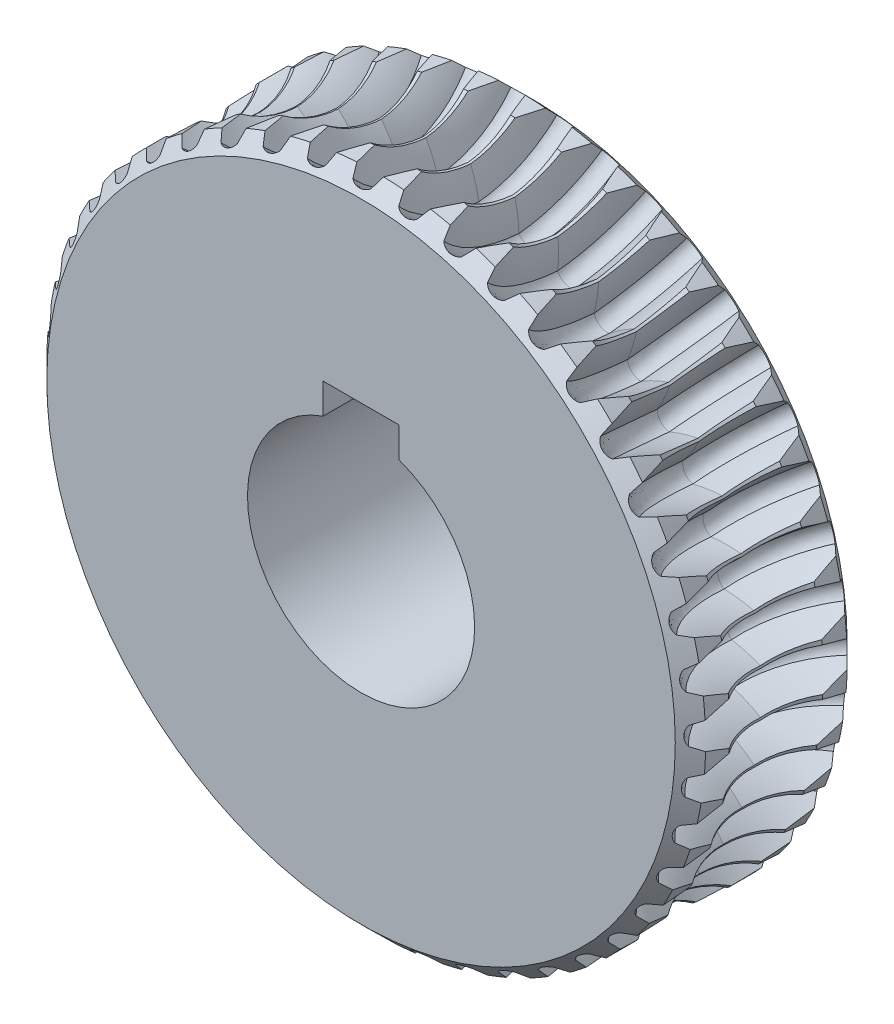
from build123d import *

# Parameters (mm, degrees)
SKETCH1_R                       = 43.5
BOSS_EXTRUDE1_DEPTH             = 11.35
CHAMFER1_SIZE                   = 2
SKETCH2_R                       = 10.5
CUT_SWEEP1_PITCH                = 6
CUT_SWEEP1_HEIGHT               = 1.5
CUT_SWEEP1_RADIUS               = 10.5
CUT_SWEEP1_START_ANGLE          = -90
CIRPATTERN1_COUNT               = 44
CIRPATTERN1_COPY_1_PITCH        = 6
CIRPATTERN1_COPY_1_HEIGHT       = 1.5
CIRPATTERN1_COPY_1_RADIUS       = 10.5
CIRPATTERN1_COPY_2_PITCH        = 6
CIRPATTERN1_COPY_2_HEIGHT       = 1.5
CIRPATTERN1_COPY_2_RADIUS       = 10.5
CIRPATTERN1_COPY_3_PITCH        = 6
CIRPATTERN1_COPY_3_HEIGHT       = 1.5
CIRPATTERN1_COPY_3_RADIUS       = 10.5
CIRPATTERN1_COPY_4_PITCH        = 6
CIRPATTERN1_COPY_4_HEIGHT       = 1.5
CIRPATTERN1_COPY_4_RADIUS       = 10.5
CIRPATTERN1_COPY_5_PITCH        = 6
CIRPATTERN1_COPY_5_HEIGHT       = 1.5
CIRPATTERN1_COPY_5_RADIUS       = 10.5
CIRPATTERN1_COPY_6_PITCH        = 6
CIRPATTERN1_COPY_6_HEIGHT       = 1.5
CIRPATTERN1_COPY_6_RADIUS       = 10.5
CIRPATTERN1_COPY_6_START_ANGLE  = 180
CIRPATTERN1_COPY_7_PITCH        = 6
CIRPATTERN1_COPY_7_HEIGHT       = 1.5
CIRPATTERN1_COPY_7_RADIUS       = 10.5
CIRPATTERN1_COPY_7_START_ANGLE  = 180
CIRPATTERN1_COPY_8_PITCH        = 6
CIRPATTERN1_COPY_8_HEIGHT       = 1.5
CIRPATTERN1_COPY_8_RADIUS       = 10.5
CIRPATTERN1_COPY_8_START_ANGLE  = 180
CIRPATTERN1_COPY_9_PITCH        = 6
CIRPATTERN1_COPY_9_HEIGHT       = 1.5
CIRPATTERN1_COPY_9_RADIUS       = 10.5
CIRPATTERN1_COPY_9_START_ANGLE  = 180
CIRPATTERN1_COPY_10_PITCH       = 6
CIRPATTERN1_COPY_10_HEIGHT      = 1.5
CIRPATTERN1_COPY_10_RADIUS      = 10.5
CIRPATTERN1_COPY_10_START_ANGLE = 180
CIRPATTERN1_COPY_11_PITCH       = 6
CIRPATTERN1_COPY_11_HEIGHT      = 1.5
CIRPATTERN1_COPY_11_RADIUS      = 10.5
CIRPATTERN1_COPY_11_START_ANGLE = -90
CIRPATTERN1_COPY_12_PITCH       = 6
CIRPATTERN1_COPY_12_HEIGHT      = 1.5
CIRPATTERN1_COPY_12_RADIUS      = 10.5
CIRPATTERN1_COPY_12_START_ANGLE = 180
CIRPATTERN1_COPY_13_PITCH       = 6
CIRPATTERN1_COPY_13_HEIGHT      = 1.5
CIRPATTERN1_COPY_13_RADIUS      = 10.5
CIRPATTERN1_COPY_13_START_ANGLE = 180
CIRPATTERN1_COPY_14_PITCH       = 6
CIRPATTERN1_COPY_14_HEIGHT      = 1.5
CIRPATTERN1_COPY_14_RADIUS      = 10.5
CIRPATTERN1_COPY_14_START_ANGLE = 180
CIRPATTERN1_COPY_15_PITCH       = 6
CIRPATTERN1_COPY_15_HEIGHT      = 1.5
CIRPATTERN1_COPY_15_RADIUS      = 10.5
CIRPATTERN1_COPY_15_START_ANGLE = 180
CIRPATTERN1_COPY_16_PITCH       = 6
CIRPATTERN1_COPY_16_HEIGHT      = 1.5
CIRPATTERN1_COPY_16_RADIUS      = 10.5
CIRPATTERN1_COPY_16_START_ANGLE = 180
CIRPATTERN1_COPY_17_PITCH       = 6
CIRPATTERN1_COPY_17_HEIGHT      = 1.5
CIRPATTERN1_COPY_17_RADIUS      = 10.5
CIRPATTERN1_COPY_18_PITCH       = 6
CIRPATTERN1_COPY_18_HEIGHT      = 1.5
CIRPATTERN1_COPY_18_RADIUS      = 10.5
CIRPATTERN1_COPY_19_PITCH       = 6
CIRPATTERN1_COPY_19_HEIGHT      = 1.5
CIRPATTERN1_COPY_19_RADIUS      = 10.5
CIRPATTERN1_COPY_20_PITCH       = 6
CIRPATTERN1_COPY_20_HEIGHT      = 1.5
CIRPATTERN1_COPY_20_RADIUS      = 10.5
CIRPATTERN1_COPY_21_PITCH       = 6
CIRPATTERN1_COPY_21_HEIGHT      = 1.5
CIRPATTERN1_COPY_21_RADIUS      = 10.5
CIRPATTERN1_COPY_22_PITCH       = 6
CIRPATTERN1_COPY_22_HEIGHT      = 1.5
CIRPATTERN1_COPY_22_RADIUS      = 10.5
CIRPATTERN1_COPY_22_START_ANGLE = 90
CIRPATTERN1_COPY_23_PITCH       = 6
CIRPATTERN1_COPY_23_HEIGHT      = 1.5
CIRPATTERN1_COPY_23_RADIUS      = 10.5
CIRPATTERN1_COPY_24_PITCH       = 6
CIRPATTERN1_COPY_24_HEIGHT      = 1.5
CIRPATTERN1_COPY_24_RADIUS      = 10.5
CIRPATTERN1_COPY_25_PITCH       = 6
CIRPATTERN1_COPY_25_HEIGHT      = 1.5
CIRPATTERN1_COPY_25_RADIUS      = 10.5
CIRPATTERN1_COPY_26_PITCH       = 6
CIRPATTERN1_COPY_26_HEIGHT      = 1.5
CIRPATTERN1_COPY_26_RADIUS      = 10.5
CIRPATTERN1_COPY_27_PITCH       = 6
CIRPATTERN1_COPY_27_HEIGHT      = 1.5
CIRPATTERN1_COPY_27_RADIUS      = 10.5
CIRPATTERN1_COPY_28_PITCH       = 6
CIRPATTERN1_COPY_28_HEIGHT      = 1.5
CIRPATTERN1_COPY_28_RADIUS      = 10.5
CIRPATTERN1_COPY_28_START_ANGLE = 180
CIRPATTERN1_COPY_29_PITCH       = 6
CIRPATTERN1_COPY_29_HEIGHT      = 1.5
CIRPATTERN1_COPY_29_RADIUS      = 10.5
CIRPATTERN1_COPY_29_START_ANGLE = 180
CIRPATTERN1_COPY_30_PITCH       = 6
CIRPATTERN1_COPY_30_HEIGHT      = 1.5
CIRPATTERN1_COPY_30_RADIUS      = 10.5
CIRPATTERN1_COPY_30_START_ANGLE = 180
CIRPATTERN1_COPY_31_PITCH       = 6
CIRPATTERN1_COPY_31_HEIGHT      = 1.5
CIRPATTERN1_COPY_31_RADIUS      = 10.5
CIRPATTERN1_COPY_31_START_ANGLE = 180
CIRPATTERN1_COPY_32_PITCH       = 6
CIRPATTERN1_COPY_32_HEIGHT      = 1.5
CIRPATTERN1_COPY_32_RADIUS      = 10.5
CIRPATTERN1_COPY_32_START_ANGLE = 180
CIRPATTERN1_COPY_33_PITCH       = 6
CIRPATTERN1_COPY_33_HEIGHT      = 1.5
CIRPATTERN1_COPY_33_RADIUS      = 10.5
CIRPATTERN1_COPY_33_START_ANGLE = 90
CIRPATTERN1_COPY_34_PITCH       = 6
CIRPATTERN1_COPY_34_HEIGHT      = 1.5
CIRPATTERN1_COPY_34_RADIUS      = 10.5
CIRPATTERN1_COPY_34_START_ANGLE = 180
CIRPATTERN1_COPY_35_PITCH       = 6
CIRPATTERN1_COPY_35_HEIGHT      = 1.5
CIRPATTERN1_COPY_35_RADIUS      = 10.5
CIRPATTERN1_COPY_35_START_ANGLE = 180
CIRPATTERN1_COPY_36_PITCH       = 6
CIRPATTERN1_COPY_36_HEIGHT      = 1.5
CIRPATTERN1_COPY_36_RADIUS      = 10.5
CIRPATTERN1_COPY_36_START_ANGLE = 180
CIRPATTERN1_COPY_37_PITCH       = 6
CIRPATTERN1_COPY_37_HEIGHT      = 1.5
CIRPATTERN1_COPY_37_RADIUS      = 10.5
CIRPATTERN1_COPY_37_START_ANGLE = 180
CIRPATTERN1_COPY_38_PITCH       = 6
CIRPATTERN1_COPY_38_HEIGHT      = 1.5
CIRPATTERN1_COPY_38_RADIUS      = 10.5
CIRPATTERN1_COPY_38_START_ANGLE = 180
CIRPATTERN1_COPY_39_PITCH       = 6
CIRPATTERN1_COPY_39_HEIGHT      = 1.5
CIRPATTERN1_COPY_39_RADIUS      = 10.5
CIRPATTERN1_COPY_40_PITCH       = 6
CIRPATTERN1_COPY_40_HEIGHT      = 1.5
CIRPATTERN1_COPY_40_RADIUS      = 10.5
CIRPATTERN1_COPY_41_PITCH       = 6
CIRPATTERN1_COPY_41_HEIGHT      = 1.5
CIRPATTERN1_COPY_41_RADIUS      = 10.5
CIRPATTERN1_COPY_42_PITCH       = 6
CIRPATTERN1_COPY_42_HEIGHT      = 1.5
CIRPATTERN1_COPY_42_RADIUS      = 10.5
CIRPATTERN1_COPY_43_PITCH       = 6
CIRPATTERN1_COPY_43_HEIGHT      = 1.5
CIRPATTERN1_COPY_43_RADIUS      = 10.5


with BuildPart() as part:
    # Sketch1 → Boss-Extrude1 (new, symmetric)
    with BuildSketch(Plane.XY):
        Circle(SKETCH1_R)
        with BuildLine():
            Line((-5, 18.142135624), (5, 18.142135624))
            Line((5, 18.142135624), (5, 14.142135624))
            ThreePointArc((5, 14.142135624), (0, -15), (-5, 14.142135624))
            Line((-5, 14.142135624), (-5, 18.142135624))
        make_face(mode=Mode.SUBTRACT)
    extrude(amount=BOSS_EXTRUDE1_DEPTH, both=True)

    # Chamfer1
    chamfer1_edges = [part.edges().sort_by_distance(p)[0] for p in [
        (-43.5, 0, -11.35),
        (-43.5, 0, 11.35),
    ]]
    chamfer(chamfer1_edges, length=CHAMFER1_SIZE)

    # Sketch2 → Cut-Revolve1 (revolve, cut)
    with BuildSketch(Plane(origin=(0, 0, 0), x_dir=(0, 0, -1), z_dir=(1, 0, 0)), mode=Mode.PRIVATE) as cut_revolve1_sk:
        with Locations((0, -52)):
            Circle(SKETCH2_R)
    revolve(cut_revolve1_sk.sketch.rotate(Axis((0, 0, 11.35), (0, 0, -1)), 270), axis=Axis((0, 0, 11.35), (0, 0, -1)), mode=Mode.SUBTRACT)

    # Cut-Sweep1: sweep along a helix
    with BuildLine() as cut_sweep1_path:
        add(Helix(CUT_SWEEP1_PITCH, CUT_SWEEP1_HEIGHT, CUT_SWEEP1_RADIUS, center=(0, -52, 0), direction=(1, 0, 0), mode=Mode.PRIVATE).rotate(Axis((0, -52, 0), (1, 0, 0)), CUT_SWEEP1_START_ANGLE))
    # Sketch4 → Cut-Sweep1 (sweep, cut)
    with BuildSketch(Plane.XY):
        with BuildLine():
            Line((3.45, -44.44), (-3.45, -44.44))
            Line((-3.45, -44.44), (-3.45, -42.44))
            ThreePointArc((-3.45, -42.44), (-2.158263743, -40.196055995), (-1.201831935, -37.79))
            ThreePointArc((-1.201831935, -37.79), (0, -37.33), (1.201831935, -37.79))
            ThreePointArc((1.201831935, -37.79), (2.158263743, -40.196055995), (3.45, -42.44))
            Line((3.45, -42.44), (3.45, -44.44))
        make_face()
    cut_sweep1 = sweep(path=cut_sweep1_path.line, is_frenet=True, mode=Mode.SUBTRACT)

    # Mirror1: Cut-Sweep1 across plane
    add(cut_sweep1.mirror(Plane.XY), mode=Mode.SUBTRACT)

    # CirPattern1: Cut-Sweep1 ×44 about axis
    cirpattern1_axis = Axis((0, 0, 11.35), (0, 0, 1))
    for i in range(1, CIRPATTERN1_COUNT):
        add(cut_sweep1.rotate(cirpattern1_axis, i * 360 / CIRPATTERN1_COUNT), mode=Mode.SUBTRACT)

    # CirPattern1 copy 1: sweep along a helix
    with BuildLine() as cirpattern1_copy_1_path:
        Helix(CIRPATTERN1_COPY_1_PITCH, CIRPATTERN1_COPY_1_HEIGHT, CIRPATTERN1_COPY_1_RADIUS, center=(7.40037159, -51.470714978, 0), direction=(0.9898214418809327, 0.14231483827328514, 0), lefthand=True)
    # CirPattern1 copy 1 sketch → CirPattern1 copy 1 (sweep, cut)
    with BuildSketch(Plane(origin=(0, 0, 0), x_dir=(0.9898214418809327, 0.14231483827328514, 0), z_dir=(0, 0, -1))):
        with BuildLine():
            Line((3.45, 44.44), (-3.45, 44.44))
            Line((-3.45, 44.44), (-3.45, 42.44))
            ThreePointArc((-3.45, 42.44), (-2.158263743, 40.196055995), (-1.201831935, 37.79))
            ThreePointArc((-1.201831935, 37.79), (0, 37.33), (1.201831935, 37.79))
            ThreePointArc((1.201831935, 37.79), (2.158263743, 40.196055995), (3.45, 42.44))
            Line((3.45, 42.44), (3.45, 44.44))
        make_face()
    sweep(path=cirpattern1_copy_1_path.line, is_frenet=True, mode=Mode.SUBTRACT)

    # CirPattern1 copy 2: sweep along a helix
    with BuildLine() as cirpattern1_copy_2_path:
        Helix(CIRPATTERN1_COPY_2_PITCH, CIRPATTERN1_COPY_2_HEIGHT, CIRPATTERN1_COPY_2_RADIUS, center=(14.650092956, -49.893634628, 0), direction=(0.9594929736144974, 0.28173255684142967, 0), lefthand=True)
    # CirPattern1 copy 2 sketch → CirPattern1 copy 2 (sweep, cut)
    with BuildSketch(Plane(origin=(0, 0, 0), x_dir=(0.9594929736144974, 0.28173255684142967, 0), z_dir=(0, 0, -1))):
        with BuildLine():
            Line((3.45, 44.44), (-3.45, 44.44))
            Line((-3.45, 44.44), (-3.45, 42.44))
            ThreePointArc((-3.45, 42.44), (-2.158263743, 40.196055995), (-1.201831935, 37.79))
            ThreePointArc((-1.201831935, 37.79), (0, 37.33), (1.201831935, 37.79))
            ThreePointArc((1.201831935, 37.79), (2.158263743, 40.196055995), (3.45, 42.44))
            Line((3.45, 42.44), (3.45, 44.44))
        make_face()
    sweep(path=cirpattern1_copy_2_path.line, is_frenet=True, mode=Mode.SUBTRACT)

    # CirPattern1 copy 3: sweep along a helix
    with BuildLine() as cirpattern1_copy_3_path:
        Helix(CIRPATTERN1_COPY_3_PITCH, CIRPATTERN1_COPY_3_HEIGHT, CIRPATTERN1_COPY_3_RADIUS, center=(21.601580676, -47.300863758, 0), direction=(0.9096319953545183, 0.41541501300188644, 0), lefthand=True)
    # CirPattern1 copy 3 sketch → CirPattern1 copy 3 (sweep, cut)
    with BuildSketch(Plane(origin=(0, 0, 0), x_dir=(0.9096319953545183, 0.41541501300188644, 0), z_dir=(0, 0, -1))):
        with BuildLine():
            Line((3.45, 44.44), (-3.45, 44.44))
            Line((-3.45, 44.44), (-3.45, 42.44))
            ThreePointArc((-3.45, 42.44), (-2.158263743, 40.196055995), (-1.201831935, 37.79))
            ThreePointArc((-1.201831935, 37.79), (0, 37.33), (1.201831935, 37.79))
            ThreePointArc((1.201831935, 37.79), (2.158263743, 40.196055995), (3.45, 42.44))
            Line((3.45, 42.44), (3.45, 44.44))
        make_face()
    sweep(path=cirpattern1_copy_3_path.line, is_frenet=True, mode=Mode.SUBTRACT)

    # CirPattern1 copy 4: sweep along a helix
    with BuildLine() as cirpattern1_copy_4_path:
        Helix(CIRPATTERN1_COPY_4_PITCH, CIRPATTERN1_COPY_4_HEIGHT, CIRPATTERN1_COPY_4_RADIUS, center=(28.113322508, -43.745183707, 0), direction=(0.8412535328311812, 0.5406408174555976, 0), lefthand=True)
    # CirPattern1 copy 4 sketch → CirPattern1 copy 4 (sweep, cut)
    with BuildSketch(Plane(origin=(0, 0, 0), x_dir=(0.8412535328311812, 0.5406408174555976, 0), z_dir=(0, 0, -1))):
        with BuildLine():
            Line((3.45, 44.44), (-3.45, 44.44))
            Line((-3.45, 44.44), (-3.45, 42.44))
            ThreePointArc((-3.45, 42.44), (-2.158263743, 40.196055995), (-1.201831935, 37.79))
            ThreePointArc((-1.201831935, 37.79), (0, 37.33), (1.201831935, 37.79))
            ThreePointArc((1.201831935, 37.79), (2.158263743, 40.196055995), (3.45, 42.44))
            Line((3.45, 42.44), (3.45, 44.44))
        make_face()
    sweep(path=cirpattern1_copy_4_path.line, is_frenet=True, mode=Mode.SUBTRACT)

    # CirPattern1 copy 5: sweep along a helix
    with BuildLine() as cirpattern1_copy_5_path:
        Helix(CIRPATTERN1_COPY_5_PITCH, CIRPATTERN1_COPY_5_HEIGHT, CIRPATTERN1_COPY_5_RADIUS, center=(34.052758165, -39.298977866, 0), direction=(0.7557495743542584, 0.654860733945285, 0), lefthand=True)
    # CirPattern1 copy 5 sketch → CirPattern1 copy 5 (sweep, cut)
    with BuildSketch(Plane(origin=(0, 0, 0), x_dir=(0.7557495743542584, 0.654860733945285, 0), z_dir=(0, 0, -1))):
        with BuildLine():
            Line((3.45, 44.44), (-3.45, 44.44))
            Line((-3.45, 44.44), (-3.45, 42.44))
            ThreePointArc((-3.45, 42.44), (-2.158263743, 40.196055995), (-1.201831935, 37.79))
            ThreePointArc((-1.201831935, 37.79), (0, 37.33), (1.201831935, 37.79))
            ThreePointArc((1.201831935, 37.79), (2.158263743, 40.196055995), (3.45, 42.44))
            Line((3.45, 42.44), (3.45, 44.44))
        make_face()
    sweep(path=cirpattern1_copy_5_path.line, is_frenet=True, mode=Mode.SUBTRACT)

    # CirPattern1 copy 6: sweep along a helix
    with BuildLine() as cirpattern1_copy_6_path:
        add(Helix(CIRPATTERN1_COPY_6_PITCH, CIRPATTERN1_COPY_6_HEIGHT, CIRPATTERN1_COPY_6_RADIUS, center=(39.298977866, -34.052758165, 0), direction=(0.654860733945285, 0.7557495743542583, 0), lefthand=True, mode=Mode.PRIVATE).rotate(Axis((39.298977866, -34.052758165, 0), (0.654860733945285, 0.7557495743542583, 0)), CIRPATTERN1_COPY_6_START_ANGLE))
    # CirPattern1 copy 6 sketch → CirPattern1 copy 6 (sweep, cut)
    with BuildSketch(Plane(origin=(0, 0, 0), x_dir=(0.654860733945285, 0.7557495743542583, 0), z_dir=(0, 0, -1))):
        with BuildLine():
            Line((3.45, 44.44), (-3.45, 44.44))
            Line((-3.45, 44.44), (-3.45, 42.44))
            ThreePointArc((-3.45, 42.44), (-2.158263743, 40.196055995), (-1.201831935, 37.79))
            ThreePointArc((-1.201831935, 37.79), (0, 37.33), (1.201831935, 37.79))
            ThreePointArc((1.201831935, 37.79), (2.158263743, 40.196055995), (3.45, 42.44))
            Line((3.45, 42.44), (3.45, 44.44))
        make_face()
    sweep(path=cirpattern1_copy_6_path.line, is_frenet=True, mode=Mode.SUBTRACT)

    # CirPattern1 copy 7: sweep along a helix
    with BuildLine() as cirpattern1_copy_7_path:
        add(Helix(CIRPATTERN1_COPY_7_PITCH, CIRPATTERN1_COPY_7_HEIGHT, CIRPATTERN1_COPY_7_RADIUS, center=(43.745183707, -28.113322508, 0), direction=(0.5406408174555977, 0.8412535328311811, 0), lefthand=True, mode=Mode.PRIVATE).rotate(Axis((43.745183707, -28.113322508, 0), (0.5406408174555977, 0.8412535328311811, 0)), CIRPATTERN1_COPY_7_START_ANGLE))
    # CirPattern1 copy 7 sketch → CirPattern1 copy 7 (sweep, cut)
    with BuildSketch(Plane(origin=(0, 0, 0), x_dir=(0.5406408174555977, 0.8412535328311811, 0), z_dir=(0, 0, -1))):
        with BuildLine():
            Line((3.45, 44.44), (-3.45, 44.44))
            Line((-3.45, 44.44), (-3.45, 42.44))
            ThreePointArc((-3.45, 42.44), (-2.158263743, 40.196055995), (-1.201831935, 37.79))
            ThreePointArc((-1.201831935, 37.79), (0, 37.33), (1.201831935, 37.79))
            ThreePointArc((1.201831935, 37.79), (2.158263743, 40.196055995), (3.45, 42.44))
            Line((3.45, 42.44), (3.45, 44.44))
        make_face()
    sweep(path=cirpattern1_copy_7_path.line, is_frenet=True, mode=Mode.SUBTRACT)

    # CirPattern1 copy 8: sweep along a helix
    with BuildLine() as cirpattern1_copy_8_path:
        add(Helix(CIRPATTERN1_COPY_8_PITCH, CIRPATTERN1_COPY_8_HEIGHT, CIRPATTERN1_COPY_8_RADIUS, center=(47.300863758, -21.601580676, 0), direction=(0.41541501300188644, 0.9096319953545183, 0), lefthand=True, mode=Mode.PRIVATE).rotate(Axis((47.300863758, -21.601580676, 0), (0.41541501300188644, 0.9096319953545183, 0)), CIRPATTERN1_COPY_8_START_ANGLE))
    # CirPattern1 copy 8 sketch → CirPattern1 copy 8 (sweep, cut)
    with BuildSketch(Plane(origin=(0, 0, 0), x_dir=(0.41541501300188644, 0.9096319953545183, 0), z_dir=(0, 0, -1))):
        with BuildLine():
            Line((3.45, 44.44), (-3.45, 44.44))
            Line((-3.45, 44.44), (-3.45, 42.44))
            ThreePointArc((-3.45, 42.44), (-2.158263743, 40.196055995), (-1.201831935, 37.79))
            ThreePointArc((-1.201831935, 37.79), (0, 37.33), (1.201831935, 37.79))
            ThreePointArc((1.201831935, 37.79), (2.158263743, 40.196055995), (3.45, 42.44))
            Line((3.45, 42.44), (3.45, 44.44))
        make_face()
    sweep(path=cirpattern1_copy_8_path.line, is_frenet=True, mode=Mode.SUBTRACT)

    # CirPattern1 copy 9: sweep along a helix
    with BuildLine() as cirpattern1_copy_9_path:
        add(Helix(CIRPATTERN1_COPY_9_PITCH, CIRPATTERN1_COPY_9_HEIGHT, CIRPATTERN1_COPY_9_RADIUS, center=(49.893634628, -14.650092956, 0), direction=(0.2817325568414296, 0.9594929736144974, 0), lefthand=True, mode=Mode.PRIVATE).rotate(Axis((49.893634628, -14.650092956, 0), (0.2817325568414296, 0.9594929736144974, 0)), CIRPATTERN1_COPY_9_START_ANGLE))
    # CirPattern1 copy 9 sketch → CirPattern1 copy 9 (sweep, cut)
    with BuildSketch(Plane(origin=(0, 0, 0), x_dir=(0.2817325568414296, 0.9594929736144974, 0), z_dir=(0, 0, -1))):
        with BuildLine():
            Line((3.45, 44.44), (-3.45, 44.44))
            Line((-3.45, 44.44), (-3.45, 42.44))
            ThreePointArc((-3.45, 42.44), (-2.158263743, 40.196055995), (-1.201831935, 37.79))
            ThreePointArc((-1.201831935, 37.79), (0, 37.33), (1.201831935, 37.79))
            ThreePointArc((1.201831935, 37.79), (2.158263743, 40.196055995), (3.45, 42.44))
            Line((3.45, 42.44), (3.45, 44.44))
        make_face()
    sweep(path=cirpattern1_copy_9_path.line, is_frenet=True, mode=Mode.SUBTRACT)

    # CirPattern1 copy 10: sweep along a helix
    with BuildLine() as cirpattern1_copy_10_path:
        add(Helix(CIRPATTERN1_COPY_10_PITCH, CIRPATTERN1_COPY_10_HEIGHT, CIRPATTERN1_COPY_10_RADIUS, center=(51.470714978, -7.40037159, 0), direction=(0.14231483827328534, 0.9898214418809327, 0), lefthand=True, mode=Mode.PRIVATE).rotate(Axis((51.470714978, -7.40037159, 0), (0.14231483827328534, 0.9898214418809327, 0)), CIRPATTERN1_COPY_10_START_ANGLE))
    # CirPattern1 copy 10 sketch → CirPattern1 copy 10 (sweep, cut)
    with BuildSketch(Plane(origin=(0, 0, 0), x_dir=(0.14231483827328534, 0.9898214418809327, 0), z_dir=(0, 0, -1))):
        with BuildLine():
            Line((3.45, 44.44), (-3.45, 44.44))
            Line((-3.45, 44.44), (-3.45, 42.44))
            ThreePointArc((-3.45, 42.44), (-2.158263743, 40.196055995), (-1.201831935, 37.79))
            ThreePointArc((-1.201831935, 37.79), (0, 37.33), (1.201831935, 37.79))
            ThreePointArc((1.201831935, 37.79), (2.158263743, 40.196055995), (3.45, 42.44))
            Line((3.45, 42.44), (3.45, 44.44))
        make_face()
    sweep(path=cirpattern1_copy_10_path.line, is_frenet=True, mode=Mode.SUBTRACT)

    # CirPattern1 copy 11: sweep along a helix
    with BuildLine() as cirpattern1_copy_11_path:
        add(Helix(CIRPATTERN1_COPY_11_PITCH, CIRPATTERN1_COPY_11_HEIGHT, CIRPATTERN1_COPY_11_RADIUS, center=(52, 0, 0), direction=(0, 1, 0), lefthand=True, mode=Mode.PRIVATE).rotate(Axis((52, 0, 0), (0, 1, 0)), CIRPATTERN1_COPY_11_START_ANGLE))
    # CirPattern1 copy 11 sketch → CirPattern1 copy 11 (sweep, cut)
    with BuildSketch(Plane.YX):
        with BuildLine():
            Line((3.45, 44.44), (-3.45, 44.44))
            Line((-3.45, 44.44), (-3.45, 42.44))
            ThreePointArc((-3.45, 42.44), (-2.158263743, 40.196055995), (-1.201831935, 37.79))
            ThreePointArc((-1.201831935, 37.79), (0, 37.33), (1.201831935, 37.79))
            ThreePointArc((1.201831935, 37.79), (2.158263743, 40.196055995), (3.45, 42.44))
            Line((3.45, 42.44), (3.45, 44.44))
        make_face()
    sweep(path=cirpattern1_copy_11_path.line, is_frenet=True, mode=Mode.SUBTRACT)

    # CirPattern1 copy 12: sweep along a helix
    with BuildLine() as cirpattern1_copy_12_path:
        add(Helix(CIRPATTERN1_COPY_12_PITCH, CIRPATTERN1_COPY_12_HEIGHT, CIRPATTERN1_COPY_12_RADIUS, center=(51.470714978, 7.40037159, 0), direction=(-0.14231483827328523, 0.9898214418809327, 0), lefthand=True, mode=Mode.PRIVATE).rotate(Axis((51.470714978, 7.40037159, 0), (-0.14231483827328523, 0.9898214418809327, 0)), CIRPATTERN1_COPY_12_START_ANGLE))
    # CirPattern1 copy 12 sketch → CirPattern1 copy 12 (sweep, cut)
    with BuildSketch(Plane(origin=(0, 0, 0), x_dir=(-0.14231483827328523, 0.9898214418809327, 0), z_dir=(0, 0, -1))):
        with BuildLine():
            Line((3.45, 44.44), (-3.45, 44.44))
            Line((-3.45, 44.44), (-3.45, 42.44))
            ThreePointArc((-3.45, 42.44), (-2.158263743, 40.196055995), (-1.201831935, 37.79))
            ThreePointArc((-1.201831935, 37.79), (0, 37.33), (1.201831935, 37.79))
            ThreePointArc((1.201831935, 37.79), (2.158263743, 40.196055995), (3.45, 42.44))
            Line((3.45, 42.44), (3.45, 44.44))
        make_face()
    sweep(path=cirpattern1_copy_12_path.line, is_frenet=True, mode=Mode.SUBTRACT)

    # CirPattern1 copy 13: sweep along a helix
    with BuildLine() as cirpattern1_copy_13_path:
        add(Helix(CIRPATTERN1_COPY_13_PITCH, CIRPATTERN1_COPY_13_HEIGHT, CIRPATTERN1_COPY_13_RADIUS, center=(49.893634628, 14.650092956, 0), direction=(-0.28173255684142967, 0.9594929736144974, 0), lefthand=True, mode=Mode.PRIVATE).rotate(Axis((49.893634628, 14.650092956, 0), (-0.28173255684142967, 0.9594929736144974, 0)), CIRPATTERN1_COPY_13_START_ANGLE))
    # CirPattern1 copy 13 sketch → CirPattern1 copy 13 (sweep, cut)
    with BuildSketch(Plane(origin=(0, 0, 0), x_dir=(-0.28173255684142967, 0.9594929736144974, 0), z_dir=(0, 0, -1))):
        with BuildLine():
            Line((3.45, 44.44), (-3.45, 44.44))
            Line((-3.45, 44.44), (-3.45, 42.44))
            ThreePointArc((-3.45, 42.44), (-2.158263743, 40.196055995), (-1.201831935, 37.79))
            ThreePointArc((-1.201831935, 37.79), (0, 37.33), (1.201831935, 37.79))
            ThreePointArc((1.201831935, 37.79), (2.158263743, 40.196055995), (3.45, 42.44))
            Line((3.45, 42.44), (3.45, 44.44))
        make_face()
    sweep(path=cirpattern1_copy_13_path.line, is_frenet=True, mode=Mode.SUBTRACT)

    # CirPattern1 copy 14: sweep along a helix
    with BuildLine() as cirpattern1_copy_14_path:
        add(Helix(CIRPATTERN1_COPY_14_PITCH, CIRPATTERN1_COPY_14_HEIGHT, CIRPATTERN1_COPY_14_RADIUS, center=(47.300863758, 21.601580676, 0), direction=(-0.4154150130018863, 0.9096319953545184, 0), lefthand=True, mode=Mode.PRIVATE).rotate(Axis((47.300863758, 21.601580676, 0), (-0.4154150130018863, 0.9096319953545184, 0)), CIRPATTERN1_COPY_14_START_ANGLE))
    # CirPattern1 copy 14 sketch → CirPattern1 copy 14 (sweep, cut)
    with BuildSketch(Plane(origin=(0, 0, 0), x_dir=(-0.4154150130018863, 0.9096319953545184, 0), z_dir=(0, 0, -1))):
        with BuildLine():
            Line((3.45, 44.44), (-3.45, 44.44))
            Line((-3.45, 44.44), (-3.45, 42.44))
            ThreePointArc((-3.45, 42.44), (-2.158263743, 40.196055995), (-1.201831935, 37.79))
            ThreePointArc((-1.201831935, 37.79), (0, 37.33), (1.201831935, 37.79))
            ThreePointArc((1.201831935, 37.79), (2.158263743, 40.196055995), (3.45, 42.44))
            Line((3.45, 42.44), (3.45, 44.44))
        make_face()
    sweep(path=cirpattern1_copy_14_path.line, is_frenet=True, mode=Mode.SUBTRACT)

    # CirPattern1 copy 15: sweep along a helix
    with BuildLine() as cirpattern1_copy_15_path:
        add(Helix(CIRPATTERN1_COPY_15_PITCH, CIRPATTERN1_COPY_15_HEIGHT, CIRPATTERN1_COPY_15_RADIUS, center=(43.745183707, 28.113322508, 0), direction=(-0.5406408174555977, 0.8412535328311811, 0), lefthand=True, mode=Mode.PRIVATE).rotate(Axis((43.745183707, 28.113322508, 0), (-0.5406408174555977, 0.8412535328311811, 0)), CIRPATTERN1_COPY_15_START_ANGLE))
    # CirPattern1 copy 15 sketch → CirPattern1 copy 15 (sweep, cut)
    with BuildSketch(Plane(origin=(0, 0, 0), x_dir=(-0.5406408174555977, 0.8412535328311811, 0), z_dir=(0, 0, -1))):
        with BuildLine():
            Line((3.45, 44.44), (-3.45, 44.44))
            Line((-3.45, 44.44), (-3.45, 42.44))
            ThreePointArc((-3.45, 42.44), (-2.158263743, 40.196055995), (-1.201831935, 37.79))
            ThreePointArc((-1.201831935, 37.79), (0, 37.33), (1.201831935, 37.79))
            ThreePointArc((1.201831935, 37.79), (2.158263743, 40.196055995), (3.45, 42.44))
            Line((3.45, 42.44), (3.45, 44.44))
        make_face()
    sweep(path=cirpattern1_copy_15_path.line, is_frenet=True, mode=Mode.SUBTRACT)

    # CirPattern1 copy 16: sweep along a helix
    with BuildLine() as cirpattern1_copy_16_path:
        add(Helix(CIRPATTERN1_COPY_16_PITCH, CIRPATTERN1_COPY_16_HEIGHT, CIRPATTERN1_COPY_16_RADIUS, center=(39.298977866, 34.052758165, 0), direction=(-0.654860733945285, 0.7557495743542583, 0), lefthand=True, mode=Mode.PRIVATE).rotate(Axis((39.298977866, 34.052758165, 0), (-0.654860733945285, 0.7557495743542583, 0)), CIRPATTERN1_COPY_16_START_ANGLE))
    # CirPattern1 copy 16 sketch → CirPattern1 copy 16 (sweep, cut)
    with BuildSketch(Plane(origin=(0, 0, 0), x_dir=(-0.654860733945285, 0.7557495743542583, 0), z_dir=(0, 0, -1))):
        with BuildLine():
            Line((3.45, 44.44), (-3.45, 44.44))
            Line((-3.45, 44.44), (-3.45, 42.44))
            ThreePointArc((-3.45, 42.44), (-2.158263743, 40.196055995), (-1.201831935, 37.79))
            ThreePointArc((-1.201831935, 37.79), (0, 37.33), (1.201831935, 37.79))
            ThreePointArc((1.201831935, 37.79), (2.158263743, 40.196055995), (3.45, 42.44))
            Line((3.45, 42.44), (3.45, 44.44))
        make_face()
    sweep(path=cirpattern1_copy_16_path.line, is_frenet=True, mode=Mode.SUBTRACT)

    # CirPattern1 copy 17: sweep along a helix
    with BuildLine() as cirpattern1_copy_17_path:
        Helix(CIRPATTERN1_COPY_17_PITCH, CIRPATTERN1_COPY_17_HEIGHT, CIRPATTERN1_COPY_17_RADIUS, center=(34.052758165, 39.298977866, 0), direction=(-0.7557495743542582, 0.6548607339452852, 0), lefthand=True)
    # CirPattern1 copy 17 sketch → CirPattern1 copy 17 (sweep, cut)
    with BuildSketch(Plane(origin=(0, 0, 0), x_dir=(-0.7557495743542582, 0.6548607339452852, 0), z_dir=(0, 0, -1))):
        with BuildLine():
            Line((3.45, 44.44), (-3.45, 44.44))
            Line((-3.45, 44.44), (-3.45, 42.44))
            ThreePointArc((-3.45, 42.44), (-2.158263743, 40.196055995), (-1.201831935, 37.79))
            ThreePointArc((-1.201831935, 37.79), (0, 37.33), (1.201831935, 37.79))
            ThreePointArc((1.201831935, 37.79), (2.158263743, 40.196055995), (3.45, 42.44))
            Line((3.45, 42.44), (3.45, 44.44))
        make_face()
    sweep(path=cirpattern1_copy_17_path.line, is_frenet=True, mode=Mode.SUBTRACT)

    # CirPattern1 copy 18: sweep along a helix
    with BuildLine() as cirpattern1_copy_18_path:
        Helix(CIRPATTERN1_COPY_18_PITCH, CIRPATTERN1_COPY_18_HEIGHT, CIRPATTERN1_COPY_18_RADIUS, center=(28.113322508, 43.745183707, 0), direction=(-0.8412535328311813, 0.5406408174555974, 0), lefthand=True)
    # CirPattern1 copy 18 sketch → CirPattern1 copy 18 (sweep, cut)
    with BuildSketch(Plane(origin=(0, 0, 0), x_dir=(-0.8412535328311813, 0.5406408174555974, 0), z_dir=(0, 0, -1))):
        with BuildLine():
            Line((3.45, 44.44), (-3.45, 44.44))
            Line((-3.45, 44.44), (-3.45, 42.44))
            ThreePointArc((-3.45, 42.44), (-2.158263743, 40.196055995), (-1.201831935, 37.79))
            ThreePointArc((-1.201831935, 37.79), (0, 37.33), (1.201831935, 37.79))
            ThreePointArc((1.201831935, 37.79), (2.158263743, 40.196055995), (3.45, 42.44))
            Line((3.45, 42.44), (3.45, 44.44))
        make_face()
    sweep(path=cirpattern1_copy_18_path.line, is_frenet=True, mode=Mode.SUBTRACT)

    # CirPattern1 copy 19: sweep along a helix
    with BuildLine() as cirpattern1_copy_19_path:
        Helix(CIRPATTERN1_COPY_19_PITCH, CIRPATTERN1_COPY_19_HEIGHT, CIRPATTERN1_COPY_19_RADIUS, center=(21.601580676, 47.300863758, 0), direction=(-0.9096319953545182, 0.4154150130018867, 0), lefthand=True)
    # CirPattern1 copy 19 sketch → CirPattern1 copy 19 (sweep, cut)
    with BuildSketch(Plane(origin=(0, 0, 0), x_dir=(-0.9096319953545182, 0.4154150130018867, 0), z_dir=(0, 0, -1))):
        with BuildLine():
            Line((3.45, 44.44), (-3.45, 44.44))
            Line((-3.45, 44.44), (-3.45, 42.44))
            ThreePointArc((-3.45, 42.44), (-2.158263743, 40.196055995), (-1.201831935, 37.79))
            ThreePointArc((-1.201831935, 37.79), (0, 37.33), (1.201831935, 37.79))
            ThreePointArc((1.201831935, 37.79), (2.158263743, 40.196055995), (3.45, 42.44))
            Line((3.45, 42.44), (3.45, 44.44))
        make_face()
    sweep(path=cirpattern1_copy_19_path.line, is_frenet=True, mode=Mode.SUBTRACT)

    # CirPattern1 copy 20: sweep along a helix
    with BuildLine() as cirpattern1_copy_20_path:
        Helix(CIRPATTERN1_COPY_20_PITCH, CIRPATTERN1_COPY_20_HEIGHT, CIRPATTERN1_COPY_20_RADIUS, center=(14.650092956, 49.893634628, 0), direction=(-0.9594929736144973, 0.28173255684143006, 0), lefthand=True)
    # CirPattern1 copy 20 sketch → CirPattern1 copy 20 (sweep, cut)
    with BuildSketch(Plane(origin=(0, 0, 0), x_dir=(-0.9594929736144973, 0.28173255684143006, 0), z_dir=(0, 0, -1))):
        with BuildLine():
            Line((3.45, 44.44), (-3.45, 44.44))
            Line((-3.45, 44.44), (-3.45, 42.44))
            ThreePointArc((-3.45, 42.44), (-2.158263743, 40.196055995), (-1.201831935, 37.79))
            ThreePointArc((-1.201831935, 37.79), (0, 37.33), (1.201831935, 37.79))
            ThreePointArc((1.201831935, 37.79), (2.158263743, 40.196055995), (3.45, 42.44))
            Line((3.45, 42.44), (3.45, 44.44))
        make_face()
    sweep(path=cirpattern1_copy_20_path.line, is_frenet=True, mode=Mode.SUBTRACT)

    # CirPattern1 copy 21: sweep along a helix
    with BuildLine() as cirpattern1_copy_21_path:
        Helix(CIRPATTERN1_COPY_21_PITCH, CIRPATTERN1_COPY_21_HEIGHT, CIRPATTERN1_COPY_21_RADIUS, center=(7.40037159, 51.470714978, 0), direction=(-0.9898214418809327, 0.14231483827328517, 0), lefthand=True)
    # CirPattern1 copy 21 sketch → CirPattern1 copy 21 (sweep, cut)
    with BuildSketch(Plane(origin=(0, 0, 0), x_dir=(-0.9898214418809327, 0.14231483827328517, 0), z_dir=(0, 0, -1))):
        with BuildLine():
            Line((3.45, 44.44), (-3.45, 44.44))
            Line((-3.45, 44.44), (-3.45, 42.44))
            ThreePointArc((-3.45, 42.44), (-2.158263743, 40.196055995), (-1.201831935, 37.79))
            ThreePointArc((-1.201831935, 37.79), (0, 37.33), (1.201831935, 37.79))
            ThreePointArc((1.201831935, 37.79), (2.158263743, 40.196055995), (3.45, 42.44))
            Line((3.45, 42.44), (3.45, 44.44))
        make_face()
    sweep(path=cirpattern1_copy_21_path.line, is_frenet=True, mode=Mode.SUBTRACT)

    # CirPattern1 copy 22: sweep along a helix
    with BuildLine() as cirpattern1_copy_22_path:
        add(Helix(CIRPATTERN1_COPY_22_PITCH, CIRPATTERN1_COPY_22_HEIGHT, CIRPATTERN1_COPY_22_RADIUS, center=(0, 52, 0), direction=(-1, 0, 0), lefthand=True, mode=Mode.PRIVATE).rotate(Axis((0, 52, 0), (-1, 0, 0)), CIRPATTERN1_COPY_22_START_ANGLE))
    # CirPattern1 copy 22 sketch → CirPattern1 copy 22 (sweep, cut)
    with BuildSketch(Plane(origin=(0, 0, 0), x_dir=(-1, 0, 0), z_dir=(0, 0, -1))):
        with BuildLine():
            Line((3.45, 44.44), (-3.45, 44.44))
            Line((-3.45, 44.44), (-3.45, 42.44))
            ThreePointArc((-3.45, 42.44), (-2.158263743, 40.196055995), (-1.201831935, 37.79))
            ThreePointArc((-1.201831935, 37.79), (0, 37.33), (1.201831935, 37.79))
            ThreePointArc((1.201831935, 37.79), (2.158263743, 40.196055995), (3.45, 42.44))
            Line((3.45, 42.44), (3.45, 44.44))
        make_face()
    sweep(path=cirpattern1_copy_22_path.line, is_frenet=True, mode=Mode.SUBTRACT)

    # CirPattern1 copy 23: sweep along a helix
    with BuildLine() as cirpattern1_copy_23_path:
        Helix(CIRPATTERN1_COPY_23_PITCH, CIRPATTERN1_COPY_23_HEIGHT, CIRPATTERN1_COPY_23_RADIUS, center=(-7.40037159, 51.470714978, 0), direction=(-0.9898214418809327, -0.14231483827328537, 0), lefthand=True)
    # CirPattern1 copy 23 sketch → CirPattern1 copy 23 (sweep, cut)
    with BuildSketch(Plane(origin=(0, 0, 0), x_dir=(-0.9898214418809327, -0.14231483827328537, 0), z_dir=(0, 0, -1))):
        with BuildLine():
            Line((3.45, 44.44), (-3.45, 44.44))
            Line((-3.45, 44.44), (-3.45, 42.44))
            ThreePointArc((-3.45, 42.44), (-2.158263743, 40.196055995), (-1.201831935, 37.79))
            ThreePointArc((-1.201831935, 37.79), (0, 37.33), (1.201831935, 37.79))
            ThreePointArc((1.201831935, 37.79), (2.158263743, 40.196055995), (3.45, 42.44))
            Line((3.45, 42.44), (3.45, 44.44))
        make_face()
    sweep(path=cirpattern1_copy_23_path.line, is_frenet=True, mode=Mode.SUBTRACT)

    # CirPattern1 copy 24: sweep along a helix
    with BuildLine() as cirpattern1_copy_24_path:
        Helix(CIRPATTERN1_COPY_24_PITCH, CIRPATTERN1_COPY_24_HEIGHT, CIRPATTERN1_COPY_24_RADIUS, center=(-14.650092956, 49.893634628, 0), direction=(-0.9594929736144974, -0.28173255684142984, 0), lefthand=True)
    # CirPattern1 copy 24 sketch → CirPattern1 copy 24 (sweep, cut)
    with BuildSketch(Plane(origin=(0, 0, 0), x_dir=(-0.9594929736144974, -0.28173255684142984, 0), z_dir=(0, 0, -1))):
        with BuildLine():
            Line((3.45, 44.44), (-3.45, 44.44))
            Line((-3.45, 44.44), (-3.45, 42.44))
            ThreePointArc((-3.45, 42.44), (-2.158263743, 40.196055995), (-1.201831935, 37.79))
            ThreePointArc((-1.201831935, 37.79), (0, 37.33), (1.201831935, 37.79))
            ThreePointArc((1.201831935, 37.79), (2.158263743, 40.196055995), (3.45, 42.44))
            Line((3.45, 42.44), (3.45, 44.44))
        make_face()
    sweep(path=cirpattern1_copy_24_path.line, is_frenet=True, mode=Mode.SUBTRACT)

    # CirPattern1 copy 25: sweep along a helix
    with BuildLine() as cirpattern1_copy_25_path:
        Helix(CIRPATTERN1_COPY_25_PITCH, CIRPATTERN1_COPY_25_HEIGHT, CIRPATTERN1_COPY_25_RADIUS, center=(-21.601580676, 47.300863758, 0), direction=(-0.9096319953545186, -0.4154150130018861, 0), lefthand=True)
    # CirPattern1 copy 25 sketch → CirPattern1 copy 25 (sweep, cut)
    with BuildSketch(Plane(origin=(0, 0, 0), x_dir=(-0.9096319953545186, -0.4154150130018861, 0), z_dir=(0, 0, -1))):
        with BuildLine():
            Line((3.45, 44.44), (-3.45, 44.44))
            Line((-3.45, 44.44), (-3.45, 42.44))
            ThreePointArc((-3.45, 42.44), (-2.158263743, 40.196055995), (-1.201831935, 37.79))
            ThreePointArc((-1.201831935, 37.79), (0, 37.33), (1.201831935, 37.79))
            ThreePointArc((1.201831935, 37.79), (2.158263743, 40.196055995), (3.45, 42.44))
            Line((3.45, 42.44), (3.45, 44.44))
        make_face()
    sweep(path=cirpattern1_copy_25_path.line, is_frenet=True, mode=Mode.SUBTRACT)

    # CirPattern1 copy 26: sweep along a helix
    with BuildLine() as cirpattern1_copy_26_path:
        Helix(CIRPATTERN1_COPY_26_PITCH, CIRPATTERN1_COPY_26_HEIGHT, CIRPATTERN1_COPY_26_RADIUS, center=(-28.113322508, 43.745183707, 0), direction=(-0.8412535328311812, -0.5406408174555976, 0), lefthand=True)
    # CirPattern1 copy 26 sketch → CirPattern1 copy 26 (sweep, cut)
    with BuildSketch(Plane(origin=(0, 0, 0), x_dir=(-0.8412535328311812, -0.5406408174555976, 0), z_dir=(0, 0, -1))):
        with BuildLine():
            Line((3.45, 44.44), (-3.45, 44.44))
            Line((-3.45, 44.44), (-3.45, 42.44))
            ThreePointArc((-3.45, 42.44), (-2.158263743, 40.196055995), (-1.201831935, 37.79))
            ThreePointArc((-1.201831935, 37.79), (0, 37.33), (1.201831935, 37.79))
            ThreePointArc((1.201831935, 37.79), (2.158263743, 40.196055995), (3.45, 42.44))
            Line((3.45, 42.44), (3.45, 44.44))
        make_face()
    sweep(path=cirpattern1_copy_26_path.line, is_frenet=True, mode=Mode.SUBTRACT)

    # CirPattern1 copy 27: sweep along a helix
    with BuildLine() as cirpattern1_copy_27_path:
        Helix(CIRPATTERN1_COPY_27_PITCH, CIRPATTERN1_COPY_27_HEIGHT, CIRPATTERN1_COPY_27_RADIUS, center=(-34.052758165, 39.298977866, 0), direction=(-0.7557495743542584, -0.654860733945285, 0), lefthand=True)
    # CirPattern1 copy 27 sketch → CirPattern1 copy 27 (sweep, cut)
    with BuildSketch(Plane(origin=(0, 0, 0), x_dir=(-0.7557495743542584, -0.654860733945285, 0), z_dir=(0, 0, -1))):
        with BuildLine():
            Line((3.45, 44.44), (-3.45, 44.44))
            Line((-3.45, 44.44), (-3.45, 42.44))
            ThreePointArc((-3.45, 42.44), (-2.158263743, 40.196055995), (-1.201831935, 37.79))
            ThreePointArc((-1.201831935, 37.79), (0, 37.33), (1.201831935, 37.79))
            ThreePointArc((1.201831935, 37.79), (2.158263743, 40.196055995), (3.45, 42.44))
            Line((3.45, 42.44), (3.45, 44.44))
        make_face()
    sweep(path=cirpattern1_copy_27_path.line, is_frenet=True, mode=Mode.SUBTRACT)

    # CirPattern1 copy 28: sweep along a helix
    with BuildLine() as cirpattern1_copy_28_path:
        add(Helix(CIRPATTERN1_COPY_28_PITCH, CIRPATTERN1_COPY_28_HEIGHT, CIRPATTERN1_COPY_28_RADIUS, center=(-39.298977866, 34.052758165, 0), direction=(-0.6548607339452852, -0.7557495743542582, 0), lefthand=True, mode=Mode.PRIVATE).rotate(Axis((-39.298977866, 34.052758165, 0), (-0.6548607339452852, -0.7557495743542582, 0)), CIRPATTERN1_COPY_28_START_ANGLE))
    # CirPattern1 copy 28 sketch → CirPattern1 copy 28 (sweep, cut)
    with BuildSketch(Plane(origin=(0, 0, 0), x_dir=(-0.6548607339452852, -0.7557495743542582, 0), z_dir=(0, 0, -1))):
        with BuildLine():
            Line((3.45, 44.44), (-3.45, 44.44))
            Line((-3.45, 44.44), (-3.45, 42.44))
            ThreePointArc((-3.45, 42.44), (-2.158263743, 40.196055995), (-1.201831935, 37.79))
            ThreePointArc((-1.201831935, 37.79), (0, 37.33), (1.201831935, 37.79))
            ThreePointArc((1.201831935, 37.79), (2.158263743, 40.196055995), (3.45, 42.44))
            Line((3.45, 42.44), (3.45, 44.44))
        make_face()
    sweep(path=cirpattern1_copy_28_path.line, is_frenet=True, mode=Mode.SUBTRACT)

    # CirPattern1 copy 29: sweep along a helix
    with BuildLine() as cirpattern1_copy_29_path:
        add(Helix(CIRPATTERN1_COPY_29_PITCH, CIRPATTERN1_COPY_29_HEIGHT, CIRPATTERN1_COPY_29_RADIUS, center=(-43.745183707, 28.113322508, 0), direction=(-0.5406408174555974, -0.8412535328311812, 0), lefthand=True, mode=Mode.PRIVATE).rotate(Axis((-43.745183707, 28.113322508, 0), (-0.5406408174555974, -0.8412535328311812, 0)), CIRPATTERN1_COPY_29_START_ANGLE))
    # CirPattern1 copy 29 sketch → CirPattern1 copy 29 (sweep, cut)
    with BuildSketch(Plane(origin=(0, 0, 0), x_dir=(-0.5406408174555974, -0.8412535328311812, 0), z_dir=(0, 0, -1))):
        with BuildLine():
            Line((3.45, 44.44), (-3.45, 44.44))
            Line((-3.45, 44.44), (-3.45, 42.44))
            ThreePointArc((-3.45, 42.44), (-2.158263743, 40.196055995), (-1.201831935, 37.79))
            ThreePointArc((-1.201831935, 37.79), (0, 37.33), (1.201831935, 37.79))
            ThreePointArc((1.201831935, 37.79), (2.158263743, 40.196055995), (3.45, 42.44))
            Line((3.45, 42.44), (3.45, 44.44))
        make_face()
    sweep(path=cirpattern1_copy_29_path.line, is_frenet=True, mode=Mode.SUBTRACT)

    # CirPattern1 copy 30: sweep along a helix
    with BuildLine() as cirpattern1_copy_30_path:
        add(Helix(CIRPATTERN1_COPY_30_PITCH, CIRPATTERN1_COPY_30_HEIGHT, CIRPATTERN1_COPY_30_RADIUS, center=(-47.300863758, 21.601580676, 0), direction=(-0.4154150130018864, -0.9096319953545184, 0), lefthand=True, mode=Mode.PRIVATE).rotate(Axis((-47.300863758, 21.601580676, 0), (-0.4154150130018864, -0.9096319953545184, 0)), CIRPATTERN1_COPY_30_START_ANGLE))
    # CirPattern1 copy 30 sketch → CirPattern1 copy 30 (sweep, cut)
    with BuildSketch(Plane(origin=(0, 0, 0), x_dir=(-0.4154150130018864, -0.9096319953545184, 0), z_dir=(0, 0, -1))):
        with BuildLine():
            Line((3.45, 44.44), (-3.45, 44.44))
            Line((-3.45, 44.44), (-3.45, 42.44))
            ThreePointArc((-3.45, 42.44), (-2.158263743, 40.196055995), (-1.201831935, 37.79))
            ThreePointArc((-1.201831935, 37.79), (0, 37.33), (1.201831935, 37.79))
            ThreePointArc((1.201831935, 37.79), (2.158263743, 40.196055995), (3.45, 42.44))
            Line((3.45, 42.44), (3.45, 44.44))
        make_face()
    sweep(path=cirpattern1_copy_30_path.line, is_frenet=True, mode=Mode.SUBTRACT)

    # CirPattern1 copy 31: sweep along a helix
    with BuildLine() as cirpattern1_copy_31_path:
        add(Helix(CIRPATTERN1_COPY_31_PITCH, CIRPATTERN1_COPY_31_HEIGHT, CIRPATTERN1_COPY_31_RADIUS, center=(-49.893634628, 14.650092956, 0), direction=(-0.2817325568414297, -0.9594929736144974, 0), lefthand=True, mode=Mode.PRIVATE).rotate(Axis((-49.893634628, 14.650092956, 0), (-0.2817325568414297, -0.9594929736144974, 0)), CIRPATTERN1_COPY_31_START_ANGLE))
    # CirPattern1 copy 31 sketch → CirPattern1 copy 31 (sweep, cut)
    with BuildSketch(Plane(origin=(0, 0, 0), x_dir=(-0.2817325568414297, -0.9594929736144974, 0), z_dir=(0, 0, -1))):
        with BuildLine():
            Line((3.45, 44.44), (-3.45, 44.44))
            Line((-3.45, 44.44), (-3.45, 42.44))
            ThreePointArc((-3.45, 42.44), (-2.158263743, 40.196055995), (-1.201831935, 37.79))
            ThreePointArc((-1.201831935, 37.79), (0, 37.33), (1.201831935, 37.79))
            ThreePointArc((1.201831935, 37.79), (2.158263743, 40.196055995), (3.45, 42.44))
            Line((3.45, 42.44), (3.45, 44.44))
        make_face()
    sweep(path=cirpattern1_copy_31_path.line, is_frenet=True, mode=Mode.SUBTRACT)

    # CirPattern1 copy 32: sweep along a helix
    with BuildLine() as cirpattern1_copy_32_path:
        add(Helix(CIRPATTERN1_COPY_32_PITCH, CIRPATTERN1_COPY_32_HEIGHT, CIRPATTERN1_COPY_32_RADIUS, center=(-51.470714978, 7.40037159, 0), direction=(-0.14231483827328523, -0.9898214418809327, 0), lefthand=True, mode=Mode.PRIVATE).rotate(Axis((-51.470714978, 7.40037159, 0), (-0.14231483827328523, -0.9898214418809327, 0)), CIRPATTERN1_COPY_32_START_ANGLE))
    # CirPattern1 copy 32 sketch → CirPattern1 copy 32 (sweep, cut)
    with BuildSketch(Plane(origin=(0, 0, 0), x_dir=(-0.14231483827328523, -0.9898214418809327, 0), z_dir=(0, 0, -1))):
        with BuildLine():
            Line((3.45, 44.44), (-3.45, 44.44))
            Line((-3.45, 44.44), (-3.45, 42.44))
            ThreePointArc((-3.45, 42.44), (-2.158263743, 40.196055995), (-1.201831935, 37.79))
            ThreePointArc((-1.201831935, 37.79), (0, 37.33), (1.201831935, 37.79))
            ThreePointArc((1.201831935, 37.79), (2.158263743, 40.196055995), (3.45, 42.44))
            Line((3.45, 42.44), (3.45, 44.44))
        make_face()
    sweep(path=cirpattern1_copy_32_path.line, is_frenet=True, mode=Mode.SUBTRACT)

    # CirPattern1 copy 33: sweep along a helix
    with BuildLine() as cirpattern1_copy_33_path:
        add(Helix(CIRPATTERN1_COPY_33_PITCH, CIRPATTERN1_COPY_33_HEIGHT, CIRPATTERN1_COPY_33_RADIUS, center=(-52, 0, 0), direction=(0, -1, 0), lefthand=True, mode=Mode.PRIVATE).rotate(Axis((-52, 0, 0), (0, -1, 0)), CIRPATTERN1_COPY_33_START_ANGLE))
    # CirPattern1 copy 33 sketch → CirPattern1 copy 33 (sweep, cut)
    with BuildSketch(Plane(origin=(0, 0, 0), x_dir=(0, -1, 0), z_dir=(0, 0, -1))):
        with BuildLine():
            Line((3.45, 44.44), (-3.45, 44.44))
            Line((-3.45, 44.44), (-3.45, 42.44))
            ThreePointArc((-3.45, 42.44), (-2.158263743, 40.196055995), (-1.201831935, 37.79))
            ThreePointArc((-1.201831935, 37.79), (0, 37.33), (1.201831935, 37.79))
            ThreePointArc((1.201831935, 37.79), (2.158263743, 40.196055995), (3.45, 42.44))
            Line((3.45, 42.44), (3.45, 44.44))
        make_face()
    sweep(path=cirpattern1_copy_33_path.line, is_frenet=True, mode=Mode.SUBTRACT)

    # CirPattern1 copy 34: sweep along a helix
    with BuildLine() as cirpattern1_copy_34_path:
        add(Helix(CIRPATTERN1_COPY_34_PITCH, CIRPATTERN1_COPY_34_HEIGHT, CIRPATTERN1_COPY_34_RADIUS, center=(-51.470714978, -7.40037159, 0), direction=(0.14231483827328487, -0.9898214418809328, 0), lefthand=True, mode=Mode.PRIVATE).rotate(Axis((-51.470714978, -7.40037159, 0), (0.14231483827328487, -0.9898214418809328, 0)), CIRPATTERN1_COPY_34_START_ANGLE))
    # CirPattern1 copy 34 sketch → CirPattern1 copy 34 (sweep, cut)
    with BuildSketch(Plane(origin=(0, 0, 0), x_dir=(0.14231483827328487, -0.9898214418809328, 0), z_dir=(0, 0, -1))):
        with BuildLine():
            Line((3.45, 44.44), (-3.45, 44.44))
            Line((-3.45, 44.44), (-3.45, 42.44))
            ThreePointArc((-3.45, 42.44), (-2.158263743, 40.196055995), (-1.201831935, 37.79))
            ThreePointArc((-1.201831935, 37.79), (0, 37.33), (1.201831935, 37.79))
            ThreePointArc((1.201831935, 37.79), (2.158263743, 40.196055995), (3.45, 42.44))
            Line((3.45, 42.44), (3.45, 44.44))
        make_face()
    sweep(path=cirpattern1_copy_34_path.line, is_frenet=True, mode=Mode.SUBTRACT)

    # CirPattern1 copy 35: sweep along a helix
    with BuildLine() as cirpattern1_copy_35_path:
        add(Helix(CIRPATTERN1_COPY_35_PITCH, CIRPATTERN1_COPY_35_HEIGHT, CIRPATTERN1_COPY_35_RADIUS, center=(-49.893634628, -14.650092956, 0), direction=(0.2817325568414302, -0.9594929736144973, 0), lefthand=True, mode=Mode.PRIVATE).rotate(Axis((-49.893634628, -14.650092956, 0), (0.2817325568414302, -0.9594929736144973, 0)), CIRPATTERN1_COPY_35_START_ANGLE))
    # CirPattern1 copy 35 sketch → CirPattern1 copy 35 (sweep, cut)
    with BuildSketch(Plane(origin=(0, 0, 0), x_dir=(0.2817325568414302, -0.9594929736144973, 0), z_dir=(0, 0, -1))):
        with BuildLine():
            Line((3.45, 44.44), (-3.45, 44.44))
            Line((-3.45, 44.44), (-3.45, 42.44))
            ThreePointArc((-3.45, 42.44), (-2.158263743, 40.196055995), (-1.201831935, 37.79))
            ThreePointArc((-1.201831935, 37.79), (0, 37.33), (1.201831935, 37.79))
            ThreePointArc((1.201831935, 37.79), (2.158263743, 40.196055995), (3.45, 42.44))
            Line((3.45, 42.44), (3.45, 44.44))
        make_face()
    sweep(path=cirpattern1_copy_35_path.line, is_frenet=True, mode=Mode.SUBTRACT)

    # CirPattern1 copy 36: sweep along a helix
    with BuildLine() as cirpattern1_copy_36_path:
        add(Helix(CIRPATTERN1_COPY_36_PITCH, CIRPATTERN1_COPY_36_HEIGHT, CIRPATTERN1_COPY_36_RADIUS, center=(-47.300863758, -21.601580676, 0), direction=(0.4154150130018868, -0.9096319953545182, 0), lefthand=True, mode=Mode.PRIVATE).rotate(Axis((-47.300863758, -21.601580676, 0), (0.4154150130018868, -0.9096319953545182, 0)), CIRPATTERN1_COPY_36_START_ANGLE))
    # CirPattern1 copy 36 sketch → CirPattern1 copy 36 (sweep, cut)
    with BuildSketch(Plane(origin=(0, 0, 0), x_dir=(0.4154150130018868, -0.9096319953545182, 0), z_dir=(0, 0, -1))):
        with BuildLine():
            Line((3.45, 44.44), (-3.45, 44.44))
            Line((-3.45, 44.44), (-3.45, 42.44))
            ThreePointArc((-3.45, 42.44), (-2.158263743, 40.196055995), (-1.201831935, 37.79))
            ThreePointArc((-1.201831935, 37.79), (0, 37.33), (1.201831935, 37.79))
            ThreePointArc((1.201831935, 37.79), (2.158263743, 40.196055995), (3.45, 42.44))
            Line((3.45, 42.44), (3.45, 44.44))
        make_face()
    sweep(path=cirpattern1_copy_36_path.line, is_frenet=True, mode=Mode.SUBTRACT)

    # CirPattern1 copy 37: sweep along a helix
    with BuildLine() as cirpattern1_copy_37_path:
        add(Helix(CIRPATTERN1_COPY_37_PITCH, CIRPATTERN1_COPY_37_HEIGHT, CIRPATTERN1_COPY_37_RADIUS, center=(-43.745183707, -28.113322508, 0), direction=(0.5406408174555979, -0.841253532831181, 0), lefthand=True, mode=Mode.PRIVATE).rotate(Axis((-43.745183707, -28.113322508, 0), (0.5406408174555979, -0.841253532831181, 0)), CIRPATTERN1_COPY_37_START_ANGLE))
    # CirPattern1 copy 37 sketch → CirPattern1 copy 37 (sweep, cut)
    with BuildSketch(Plane(origin=(0, 0, 0), x_dir=(0.5406408174555979, -0.841253532831181, 0), z_dir=(0, 0, -1))):
        with BuildLine():
            Line((3.45, 44.44), (-3.45, 44.44))
            Line((-3.45, 44.44), (-3.45, 42.44))
            ThreePointArc((-3.45, 42.44), (-2.158263743, 40.196055995), (-1.201831935, 37.79))
            ThreePointArc((-1.201831935, 37.79), (0, 37.33), (1.201831935, 37.79))
            ThreePointArc((1.201831935, 37.79), (2.158263743, 40.196055995), (3.45, 42.44))
            Line((3.45, 42.44), (3.45, 44.44))
        make_face()
    sweep(path=cirpattern1_copy_37_path.line, is_frenet=True, mode=Mode.SUBTRACT)

    # CirPattern1 copy 38: sweep along a helix
    with BuildLine() as cirpattern1_copy_38_path:
        add(Helix(CIRPATTERN1_COPY_38_PITCH, CIRPATTERN1_COPY_38_HEIGHT, CIRPATTERN1_COPY_38_RADIUS, center=(-39.298977866, -34.052758165, 0), direction=(0.6548607339452845, -0.7557495743542587, 0), lefthand=True, mode=Mode.PRIVATE).rotate(Axis((-39.298977866, -34.052758165, 0), (0.6548607339452845, -0.7557495743542587, 0)), CIRPATTERN1_COPY_38_START_ANGLE))
    # CirPattern1 copy 38 sketch → CirPattern1 copy 38 (sweep, cut)
    with BuildSketch(Plane(origin=(0, 0, 0), x_dir=(0.6548607339452845, -0.7557495743542587, 0), z_dir=(0, 0, -1))):
        with BuildLine():
            Line((3.45, 44.44), (-3.45, 44.44))
            Line((-3.45, 44.44), (-3.45, 42.44))
            ThreePointArc((-3.45, 42.44), (-2.158263743, 40.196055995), (-1.201831935, 37.79))
            ThreePointArc((-1.201831935, 37.79), (0, 37.33), (1.201831935, 37.79))
            ThreePointArc((1.201831935, 37.79), (2.158263743, 40.196055995), (3.45, 42.44))
            Line((3.45, 42.44), (3.45, 44.44))
        make_face()
    sweep(path=cirpattern1_copy_38_path.line, is_frenet=True, mode=Mode.SUBTRACT)

    # CirPattern1 copy 39: sweep along a helix
    with BuildLine() as cirpattern1_copy_39_path:
        Helix(CIRPATTERN1_COPY_39_PITCH, CIRPATTERN1_COPY_39_HEIGHT, CIRPATTERN1_COPY_39_RADIUS, center=(-34.052758165, -39.298977866, 0), direction=(0.7557495743542578, -0.6548607339452855, 0), lefthand=True)
    # CirPattern1 copy 39 sketch → CirPattern1 copy 39 (sweep, cut)
    with BuildSketch(Plane(origin=(0, 0, 0), x_dir=(0.7557495743542578, -0.6548607339452855, 0), z_dir=(0, 0, -1))):
        with BuildLine():
            Line((3.45, 44.44), (-3.45, 44.44))
            Line((-3.45, 44.44), (-3.45, 42.44))
            ThreePointArc((-3.45, 42.44), (-2.158263743, 40.196055995), (-1.201831935, 37.79))
            ThreePointArc((-1.201831935, 37.79), (0, 37.33), (1.201831935, 37.79))
            ThreePointArc((1.201831935, 37.79), (2.158263743, 40.196055995), (3.45, 42.44))
            Line((3.45, 42.44), (3.45, 44.44))
        make_face()
    sweep(path=cirpattern1_copy_39_path.line, is_frenet=True, mode=Mode.SUBTRACT)

    # CirPattern1 copy 40: sweep along a helix
    with BuildLine() as cirpattern1_copy_40_path:
        Helix(CIRPATTERN1_COPY_40_PITCH, CIRPATTERN1_COPY_40_HEIGHT, CIRPATTERN1_COPY_40_RADIUS, center=(-28.113322508, -43.745183707, 0), direction=(0.8412535328311808, -0.5406408174555982, 0), lefthand=True)
    # CirPattern1 copy 40 sketch → CirPattern1 copy 40 (sweep, cut)
    with BuildSketch(Plane(origin=(0, 0, 0), x_dir=(0.8412535328311808, -0.5406408174555982, 0), z_dir=(0, 0, -1))):
        with BuildLine():
            Line((3.45, 44.44), (-3.45, 44.44))
            Line((-3.45, 44.44), (-3.45, 42.44))
            ThreePointArc((-3.45, 42.44), (-2.158263743, 40.196055995), (-1.201831935, 37.79))
            ThreePointArc((-1.201831935, 37.79), (0, 37.33), (1.201831935, 37.79))
            ThreePointArc((1.201831935, 37.79), (2.158263743, 40.196055995), (3.45, 42.44))
            Line((3.45, 42.44), (3.45, 44.44))
        make_face()
    sweep(path=cirpattern1_copy_40_path.line, is_frenet=True, mode=Mode.SUBTRACT)

    # CirPattern1 copy 41: sweep along a helix
    with BuildLine() as cirpattern1_copy_41_path:
        Helix(CIRPATTERN1_COPY_41_PITCH, CIRPATTERN1_COPY_41_HEIGHT, CIRPATTERN1_COPY_41_RADIUS, center=(-21.601580676, -47.300863758, 0), direction=(0.9096319953545183, -0.41541501300188644, 0), lefthand=True)
    # CirPattern1 copy 41 sketch → CirPattern1 copy 41 (sweep, cut)
    with BuildSketch(Plane(origin=(0, 0, 0), x_dir=(0.9096319953545183, -0.41541501300188644, 0), z_dir=(0, 0, -1))):
        with BuildLine():
            Line((3.45, 44.44), (-3.45, 44.44))
            Line((-3.45, 44.44), (-3.45, 42.44))
            ThreePointArc((-3.45, 42.44), (-2.158263743, 40.196055995), (-1.201831935, 37.79))
            ThreePointArc((-1.201831935, 37.79), (0, 37.33), (1.201831935, 37.79))
            ThreePointArc((1.201831935, 37.79), (2.158263743, 40.196055995), (3.45, 42.44))
            Line((3.45, 42.44), (3.45, 44.44))
        make_face()
    sweep(path=cirpattern1_copy_41_path.line, is_frenet=True, mode=Mode.SUBTRACT)

    # CirPattern1 copy 42: sweep along a helix
    with BuildLine() as cirpattern1_copy_42_path:
        Helix(CIRPATTERN1_COPY_42_PITCH, CIRPATTERN1_COPY_42_HEIGHT, CIRPATTERN1_COPY_42_RADIUS, center=(-14.650092956, -49.893634628, 0), direction=(0.9594929736144974, -0.2817325568414298, 0), lefthand=True)
    # CirPattern1 copy 42 sketch → CirPattern1 copy 42 (sweep, cut)
    with BuildSketch(Plane(origin=(0, 0, 0), x_dir=(0.9594929736144974, -0.2817325568414298, 0), z_dir=(0, 0, -1))):
        with BuildLine():
            Line((3.45, 44.44), (-3.45, 44.44))
            Line((-3.45, 44.44), (-3.45, 42.44))
            ThreePointArc((-3.45, 42.44), (-2.158263743, 40.196055995), (-1.201831935, 37.79))
            ThreePointArc((-1.201831935, 37.79), (0, 37.33), (1.201831935, 37.79))
            ThreePointArc((1.201831935, 37.79), (2.158263743, 40.196055995), (3.45, 42.44))
            Line((3.45, 42.44), (3.45, 44.44))
        make_face()
    sweep(path=cirpattern1_copy_42_path.line, is_frenet=True, mode=Mode.SUBTRACT)

    # CirPattern1 copy 43: sweep along a helix
    with BuildLine() as cirpattern1_copy_43_path:
        Helix(CIRPATTERN1_COPY_43_PITCH, CIRPATTERN1_COPY_43_HEIGHT, CIRPATTERN1_COPY_43_RADIUS, center=(-7.40037159, -51.470714978, 0), direction=(0.9898214418809327, -0.1423148382732853, 0), lefthand=True)
    # CirPattern1 copy 43 sketch → CirPattern1 copy 43 (sweep, cut)
    with BuildSketch(Plane(origin=(0, 0, 0), x_dir=(0.9898214418809327, -0.1423148382732853, 0), z_dir=(0, 0, -1))):
        with BuildLine():
            Line((3.45, 44.44), (-3.45, 44.44))
            Line((-3.45, 44.44), (-3.45, 42.44))
            ThreePointArc((-3.45, 42.44), (-2.158263743, 40.196055995), (-1.201831935, 37.79))
            ThreePointArc((-1.201831935, 37.79), (0, 37.33), (1.201831935, 37.79))
            ThreePointArc((1.201831935, 37.79), (2.158263743, 40.196055995), (3.45, 42.44))
            Line((3.45, 42.44), (3.45, 44.44))
        make_face()
    sweep(path=cirpattern1_copy_43_path.line, is_frenet=True, mode=Mode.SUBTRACT)


solid = part.part
